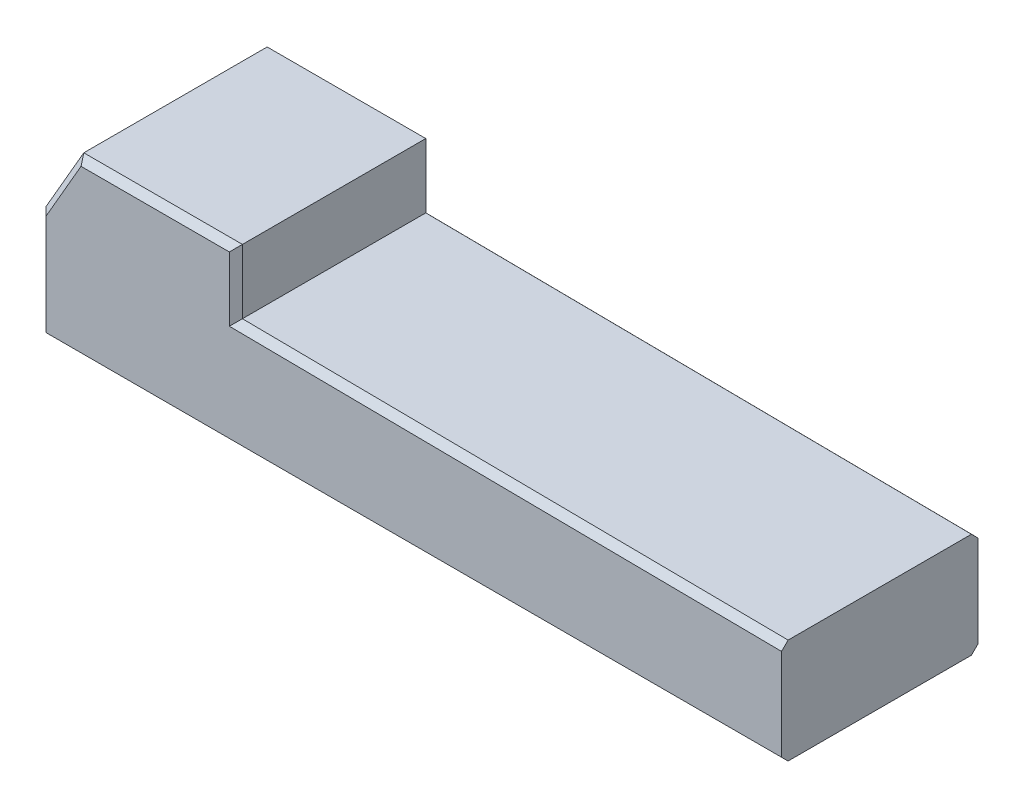
from build123d import *

# Parameters (mm, degrees)
BASEBODY_DEPTH = 36
CHAMFER1_SIZE  = 1.2


with BuildPart() as part:
    # BodySke → BaseBody (new body)
    with BuildSketch(Plane.XY):
        Polygon((80, 19.2), (80, 0), (0, 0), (-20, 0), (-56, 0), (-56, 20), (-49.07179677, 32), (-20, 32), (-20, 20.2), (0, 20), align=None)
    extrude(amount=BASEBODY_DEPTH)

    # Chamfer1
    chamfer1_edges = [part.edges().sort_by_distance(p)[0] for p in [
        (30, 19.7, 0),
        (12, 0, 0),
        (12, 0, 36),
        (30, 19.7, 36),
        (-34.535898385, 32, 0),
        (-52.535898385, 26, 0),
        (-56, 10, 0),
        (-56, 10, 36),
        (-52.535898385, 26, 36),
        (-34.535898385, 32, 36),
        (-20, 26.1, 36),
        (-20, 26.1, 0),
    ]]
    chamfer(chamfer1_edges, length=CHAMFER1_SIZE)


solid = part.part
